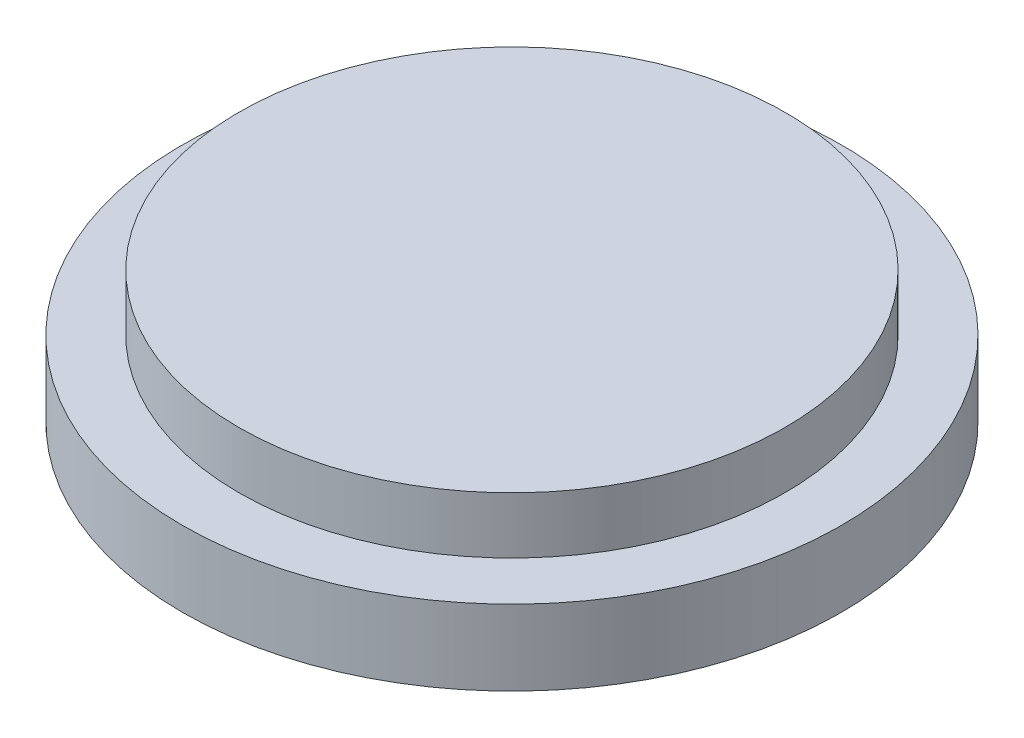
from build123d import *

# Parameters (mm, degrees)
CAP_HEAD_SKETCH_R = 35
CAP_HEAD_DEPTH    = 8
CAP_PLUG_SKETCH_R = 29
CAP_PLUG_DEPTH    = 14


with BuildPart() as part:
    # Cap Head Sketch → Cap Head (new body)
    with BuildSketch(Plane(origin=(0, 0, 0), x_dir=(1, 0, 0), z_dir=(0, 1, 0))):
        Circle(CAP_HEAD_SKETCH_R)
    extrude(amount=CAP_HEAD_DEPTH)

    # Cap Plug Sketch → Cap Plug (add)
    with BuildSketch(Plane(origin=(0, 0, 0), x_dir=(1, 0, 0), z_dir=(0, 1, 0))):
        Circle(CAP_PLUG_SKETCH_R)
    extrude(amount=CAP_PLUG_DEPTH)


solid = part.part
